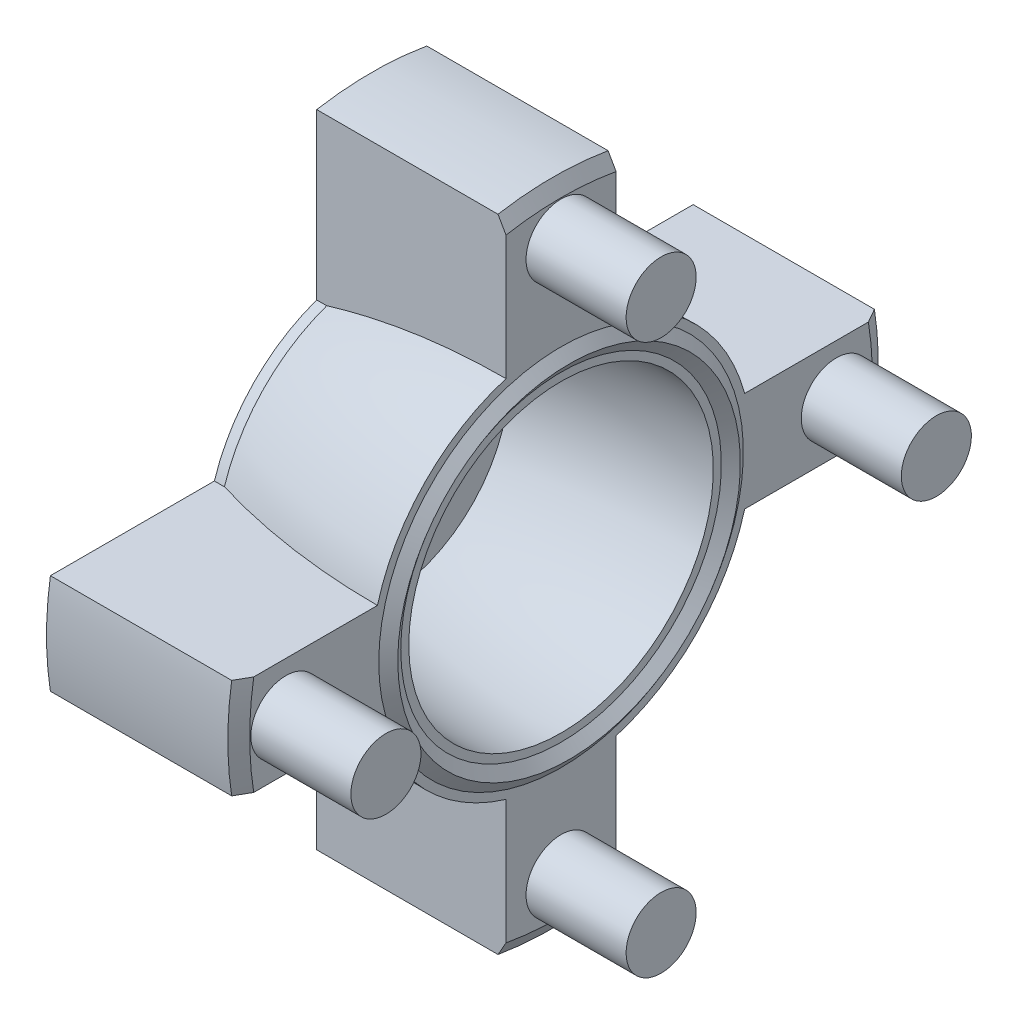
from build123d import *
from OCP.BRepFilletAPI import BRepFilletAPI_MakeChamfer

# Parameters (mm, degrees)
BOSS_EXTRUDE1_DEPTH = 18.916428128
SKETCH3_R           = 1.15
CUT_EXTRUDE1_DEPTH  = 17.416428128
CUT_EXTRUDE3_REACH  = 51.702
SKETCH10_R          = 1.1
SKETCH8_R           = 3.5
BOSS_EXTRUDE2_DEPTH = 10
CIRPATTERN2_COUNT   = 4
CHAMFER1_SIZE       = 0.8
CHAMFER1_SIZE2      = 1.385640646


# Read off the part's stored shape, not the designer's step: Roller coating 12, Roller core 12 coated
with BuildPart() as part:
    # Roller coating 12 outline → Roller coating 12 (revolve)
    with BuildSketch(Plane.YX):
        with BuildLine():
            ThreePointArc((12.7, -17.916428128), (15.217989764, 0), (12.7, 17.916428128))
            Line((12.7, 17.916428128), (8, 17.916428128))
            Line((8, 17.916428128), (8, 17.416428128))
            Line((8, 17.416428128), (12.322080058, 17.416428128))
            ThreePointArc((12.322080058, 17.416428128), (14.717989764, 0), (12.322080058, -17.416428128))
            Line((12.322080058, -17.416428128), (8, -17.416428128))
            Line((8, -17.416428128), (8, -17.916428128))
            Line((8, -17.916428128), (12.7, -17.916428128))
        make_face()
    revolve(axis=Axis((0, 0, 0), (1, 0, 0)))


with BuildPart() as body_2:
    # Roller core 12 coated outline → Roller core 12 coated (revolve)
    with BuildSketch(Plane.YX):
        with BuildLine():
            Line((1.15, 17.416428128), (1.15, -17.416428128))
            Line((1.15, -17.416428128), (12.322080058, -17.416428128))
            ThreePointArc((12.322080058, -17.416428128), (14.717989764, 0), (12.322080058, 17.416428128))
            Line((12.322080058, 17.416428128), (1.15, 17.416428128))
        make_face()
    revolve(axis=Axis((0, 0, 0), (1, 0, 0)))


with BuildPart() as part_1:
    add(part.part)

    # Combine1: union body 2
    add(body_2.part)


with BuildPart() as body_2_2:
    # Sketch1 → Revolve1 (revolve)
    with BuildSketch(Plane.XY, mode=Mode.PRIVATE) as revolve1_sk:
        with BuildLine():
            Line((0, 0), (0, 15.217989764))
            Line((0, 15.217989764), (0, 19.017989764))
            ThreePointArc((0, 19.017989764), (-9.046251562, 18.385414232), (-17.916428128, 16.5))
            Line((-17.916428128, 16.5), (-18.916428128, 16.5))
            Line((-18.916428128, 16.5), (-18.916428128, 0))
            Line((-18.916428128, 0), (0, 0))
        make_face()
    revolve(revolve1_sk.sketch.rotate(Axis((-18.916428128, 0, 0), (1, 0, 0)), 270), axis=Axis((-18.916428128, 0, 0), (1, 0, 0)))

    # Sketch5 → Boss-Extrude1 (add)
    with BuildSketch(Plane(origin=(0, 0, 0), x_dir=(0, 0, -1), z_dir=(1, 0, 0))):
        with BuildLine():
            Line((5.5, -32.031234756), (5.5, -15.556349186))
            ThreePointArc((5.5, -15.556349186), (0, -16.5), (-5.5, -15.556349186))
            Line((-5.5, -15.556349186), (-5.5, -32.031234756))
            ThreePointArc((-5.5, -32.031234756), (0, -32.5), (5.5, -32.031234756))
        make_face()
        with BuildLine():
            Line((-5.5, 32.031234756), (-5.5, 15.556349186))
            ThreePointArc((-5.5, 15.556349186), (0, 16.5), (5.5, 15.556349186))
            Line((5.5, 15.556349186), (5.5, 32.031234756))
            ThreePointArc((5.5, 32.031234756), (0, 32.5), (-5.5, 32.031234756))
        make_face()
        with BuildLine():
            Line((32.113081447, 5), (15.724185194, 5))
            ThreePointArc((15.724185194, 5), (16.5, 0), (15.724185194, -5))
            Line((15.724185194, -5), (32.113081447, -5))
            ThreePointArc((32.113081447, -5), (32.5, 0), (32.113081447, 5))
        make_face()
        with BuildLine():
            Line((-32.113081447, -5), (-15.724185194, -5))
            ThreePointArc((-15.724185194, -5), (-16.5, 0), (-15.724185194, 5))
            Line((-15.724185194, 5), (-32.113081447, 5))
            ThreePointArc((-32.113081447, 5), (-32.5, 0), (-32.113081447, -5))
        make_face()
    extrude(amount=-BOSS_EXTRUDE1_DEPTH)

    # Combine2: cut part
    add(part_1.part, mode=Mode.SUBTRACT)

    # Sketch3 → Cut-Extrude1 (cut)
    with BuildSketch(Plane(origin=(0, 0, 0), x_dir=(0, 0, -1), z_dir=(1, 0, 0))):
        Circle(SKETCH3_R)
    extrude(amount=-CUT_EXTRUDE1_DEPTH, mode=Mode.SUBTRACT)

    # Sketch10 → Cut-Extrude3 (cut, up to next)
    with BuildSketch(Plane(origin=(0, 0, 0), x_dir=(0, 0, -1), z_dir=(1, 0, 0)), mode=Mode.PRIVATE) as cut_extrude3_sk1:
        Circle(SKETCH10_R)
    cut_extrude3_tool1 = extrude(cut_extrude3_sk1.sketch, amount=-CUT_EXTRUDE3_REACH, mode=Mode.PRIVATE) & body_2_2.part
    add(cut_extrude3_tool1.solids().sort_by_distance((0, 0, 0))[0], mode=Mode.SUBTRACT)

    # Sketch4 → Revolve2 (revolve)
    with BuildSketch(Plane.XY, mode=Mode.PRIVATE) as revolve2_sk:
        Polygon((0, 18.216989764), (0.8, 17.117989764), (0, 16.018989764), align=None)
    revolve(revolve2_sk.sketch.rotate(Axis((-18.916428128, 0, 0), (1, 0, 0)), 90), axis=Axis((-18.916428128, 0, 0), (1, 0, 0)))

    # Sketch8 → Boss-Extrude2 (add)
    with BuildSketch(Plane(origin=(0, 0, 0), x_dir=(0, 0, -1), z_dir=(1, 0, 0))):
        with Locations(Location((0, -27.5, 0), (0, 0, 180))):
            Circle(SKETCH8_R)
    boss_extrude2 = extrude(amount=BOSS_EXTRUDE2_DEPTH)

    # CirPattern2: Boss-Extrude2 ×4 about axis
    cirpattern2_axis = Axis((0, 0, 0), (1, 0, 0))
    for i in range(1, CIRPATTERN2_COUNT):
        add(boss_extrude2.rotate(cirpattern2_axis, i * 360 / CIRPATTERN2_COUNT))

    # Chamfer1: one chamfer whose edges measure the first distance from different faces: ONE call of the kernel's chamfer builder (chamfer() names one face for all edges)
    chamfer1_edges_1 = [body_2_2.edges().sort_by_distance(p)[0] for p in [
        (0, -32.5, 0),
    ]]
    chamfer1_side_1 = [body_2_2.faces().sort_by_distance(p)[0] for p in [
        (-9.458214064, -32.5, 0),
    ]]
    chamfer1_edges_2 = [body_2_2.edges().sort_by_distance(p)[0] for p in [
        (0, 0, -32.5),
    ]]
    chamfer1_side_2 = [body_2_2.faces().sort_by_distance(p)[0] for p in [
        (-9.458214064, 0, -32.5),
    ]]
    chamfer1_edges_3 = [body_2_2.edges().sort_by_distance(p)[0] for p in [
        (0, 32.5, 0),
    ]]
    chamfer1_side_3 = [body_2_2.faces().sort_by_distance(p)[0] for p in [
        (-9.458214064, 32.5, 0),
    ]]
    chamfer1_edges_4 = [body_2_2.edges().sort_by_distance(p)[0] for p in [
        (0, 0, 32.5),
    ]]
    chamfer1_side_4 = [body_2_2.faces().sort_by_distance(p)[0] for p in [
        (-9.458214064, 0, 32.5),
    ]]
    chamfer1 = BRepFilletAPI_MakeChamfer(body_2_2.part.solid().wrapped)
    for e in chamfer1_edges_1:
        chamfer1.Add(CHAMFER1_SIZE, CHAMFER1_SIZE2, e.wrapped, chamfer1_side_1[0].wrapped)  # the first distance lies on this face
    for e in chamfer1_edges_2:
        chamfer1.Add(CHAMFER1_SIZE, CHAMFER1_SIZE2, e.wrapped, chamfer1_side_2[0].wrapped)  # the first distance lies on this face
    for e in chamfer1_edges_3:
        chamfer1.Add(CHAMFER1_SIZE, CHAMFER1_SIZE2, e.wrapped, chamfer1_side_3[0].wrapped)  # the first distance lies on this face
    for e in chamfer1_edges_4:
        chamfer1.Add(CHAMFER1_SIZE, CHAMFER1_SIZE2, e.wrapped, chamfer1_side_4[0].wrapped)  # the first distance lies on this face
    add(Compound.cast(chamfer1.Shape()), mode=Mode.REPLACE)


solid = body_2_2.part
